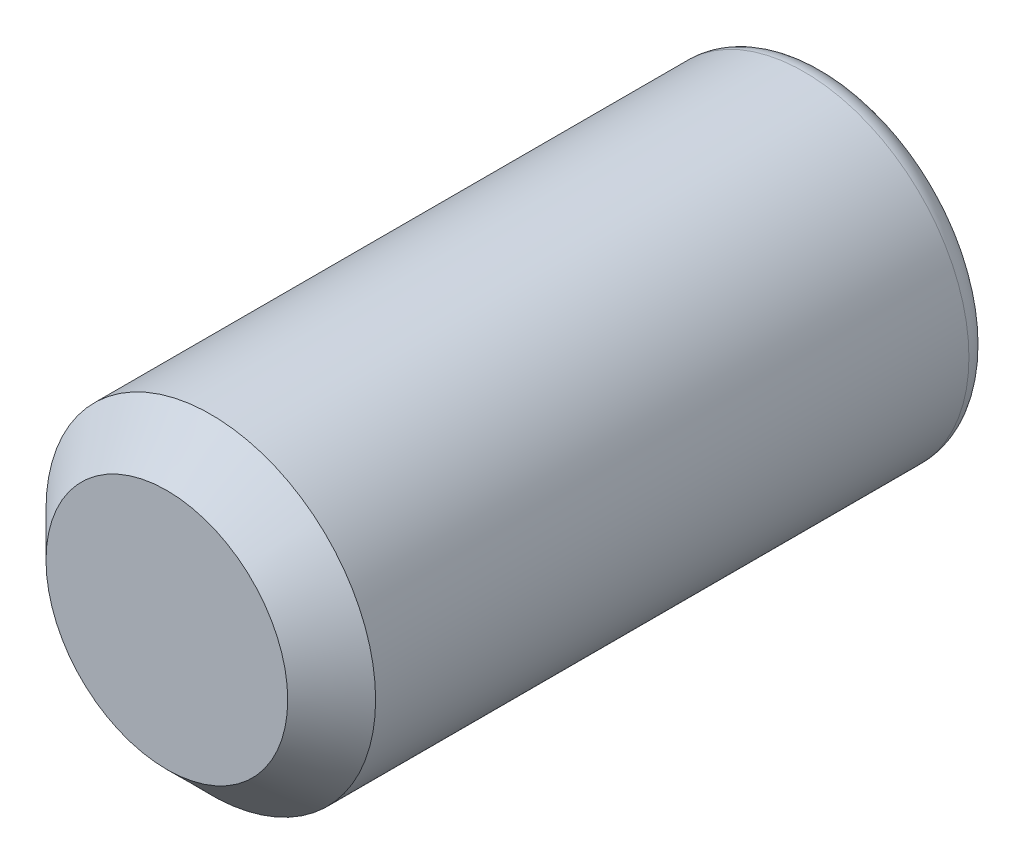
from build123d import *

# Parameters (mm, degrees)
SKETCH1_R           = 1.5
BOSS_EXTRUDE1_DEPTH = 6
CHAMFER1_SIZE       = 0.4
FILLET1_R           = 0.2
CUT_EXTRUDE1_DEPTH  = 2


with BuildPart() as part:
    # Sketch1 → Boss-Extrude1 (new body)
    with BuildSketch(Plane.XY):
        Circle(SKETCH1_R)
    extrude(amount=BOSS_EXTRUDE1_DEPTH)

    # Chamfer1
    chamfer1_edges = [part.edges().sort_by_distance(p)[0] for p in [
        (-1.5, 0, 6),
    ]]
    chamfer(chamfer1_edges, length=CHAMFER1_SIZE)

    # Fillet1
    fillet1_edges = [part.edges().sort_by_distance(p)[0] for p in [
        (-1.5, 0, 0),
    ]]
    fillet(fillet1_edges, radius=FILLET1_R)

    # Sketch2 → Cut-Extrude1 (cut)
    with BuildSketch(Plane(origin=(0, 0, 0), x_dir=(-1, 0, 0), z_dir=(0, 0, -1))):
        Polygon((0, 0.866025404), (-0.75, 0.433012702), (-0.75, -0.433012702), (0, -0.866025404), (0.75, -0.433012702), (0.75, 0.433012702), align=None)
    extrude(amount=-CUT_EXTRUDE1_DEPTH, mode=Mode.SUBTRACT)

    # Cut-Extrude2 cone 1 section (through the dimple's axis) → Cut-Extrude2 (revolve, cut)
    with BuildSketch(Plane.YZ):
        Polygon((0, 0), (0.866025404, 0), (0, 0.866025404), align=None)
    revolve(axis=Axis((0, 0, 0), (0, 0, 1)), mode=Mode.SUBTRACT)


solid = part.part
